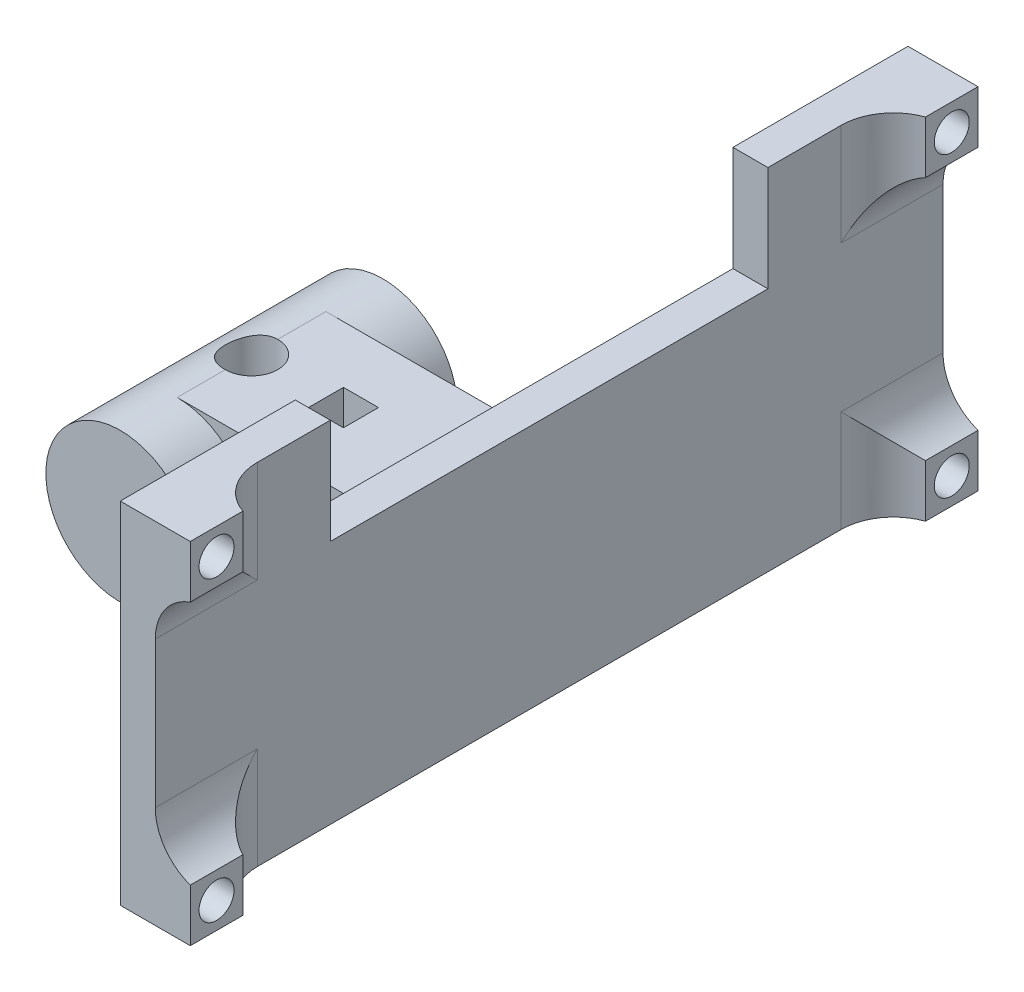
from build123d import *

# Parameters (mm, degrees)
SKETCH1_R               = 4.25
BOSS_EXTRUDE1_DEPTH     = 7.5
SKETCH2_W               = 8.5
SKETCH2_H               = 8.5
BOSS_EXTRUDE2_DEPTH     = 15
SKETCH3_W               = 45
SKETCH3_H               = 20
BOSS_EXTRUDE3_DEPTH     = 4
SKETCH4_R               = 1
CUT_EXTRUDE1_DEPTH      = 36.984371608
CUT_EXTRUDE2_DEPTH      = 2
SKETCH6_W               = 25
SKETCH6_H               = 6
CUT_EXTRUDE3_DEPTH      = 2
CUT_EXTRUDE4_DEPTH      = 32.614869919
CUT_EXTRUDE4_DEPTH_BACK = 32.614869919
SKETCH7_R               = 1.5
CUT_EXTRUDE5_DEPTH      = 34.396294705
CUT_EXTRUDE5_DEPTH_BACK = 34.396294705
SKETCH8_W               = 2
SKETCH8_H               = 2
FILLET1_R               = 3


with BuildPart() as part:
    # Sketch1 → Boss-Extrude1 (new, symmetric)
    with BuildSketch(Plane.XY):
        Circle(SKETCH1_R)
    extrude(amount=BOSS_EXTRUDE1_DEPTH, both=True)

    # Sketch2 → Boss-Extrude2 (add)
    with BuildSketch(Plane(origin=(0, 0, 0), x_dir=(0, 0, -1), z_dir=(1, 0, 0))):
        Rectangle(SKETCH2_W, SKETCH2_H)
    extrude(amount=BOSS_EXTRUDE2_DEPTH)

    # Sketch3 → Boss-Extrude3 (add)
    with BuildSketch(Plane(origin=(15, 0, 0), x_dir=(0, 0, -1), z_dir=(1, 0, 0))):
        with Locations((0, 5.75)):
            Rectangle(SKETCH3_W, SKETCH3_H)
    extrude(amount=BOSS_EXTRUDE3_DEPTH)

    # Sketch4 → Cut-Extrude1 (cut, through all)
    with BuildSketch(Plane(origin=(19, 0, 0), x_dir=(0, 0, -1), z_dir=(1, 0, 0))):
        with Locations((-21, 14.25)):
            Circle(SKETCH4_R)
        with Locations((-21, -2.75)):
            Circle(SKETCH4_R)
        with Locations((21, -2.75)):
            Circle(SKETCH4_R)
        with Locations((21, 14.25)):
            Circle(SKETCH4_R)
    extrude(amount=-CUT_EXTRUDE1_DEPTH, mode=Mode.SUBTRACT)

    # Sketch5 → Cut-Extrude2 (cut)
    with BuildSketch(Plane(origin=(19, 0, 0), x_dir=(0, 0, -1), z_dir=(1, 0, 0))):
        Polygon((19.5, 15.75), (-19.5, 15.75), (-19.5, 12.75), (-22.5, 12.75), (-22.5, -1.25), (-19.5, -1.25), (-19.5, -4.25), (19.5, -4.25), (19.5, -1.25), (22.5, -1.25), (22.5, 12.75), (19.5, 12.75), align=None)
    extrude(amount=-CUT_EXTRUDE2_DEPTH, mode=Mode.SUBTRACT)

    # Sketch6 → Cut-Extrude3 (cut)
    with BuildSketch(Plane(origin=(17, 0, 0), x_dir=(0, 0, -1), z_dir=(1, 0, 0))):
        with Locations((0, 12.75)):
            Rectangle(SKETCH6_W, SKETCH6_H)
    extrude(amount=-CUT_EXTRUDE3_DEPTH, mode=Mode.SUBTRACT)

    # Sketch7 → Cut-Extrude4 (cut, two sides: drawn at the far end of the back side and taken through both)
    with BuildSketch(Plane(origin=(0, 4.25, 0), x_dir=(1, 0, 0), z_dir=(0, 1, 0)).offset(-CUT_EXTRUDE4_DEPTH_BACK)):
        with Locations(Location((0, 0, 0), (0, 0, 270))):
            Circle(SKETCH7_R)
    extrude(amount=CUT_EXTRUDE4_DEPTH + CUT_EXTRUDE4_DEPTH_BACK, mode=Mode.SUBTRACT)

    # Sketch8 → Cut-Extrude5 (cut, two sides: drawn at the far end of the back side and taken through both)
    with BuildSketch(Plane(origin=(0, 0, 0), x_dir=(1, 0, 0), z_dir=(0, 1, 0)).offset(-CUT_EXTRUDE5_DEPTH_BACK)):
        with Locations((5.25, 0)):
            Rectangle(SKETCH8_W, SKETCH8_H)
    extrude(amount=CUT_EXTRUDE5_DEPTH + CUT_EXTRUDE5_DEPTH_BACK, mode=Mode.SUBTRACT)

    # Fillet1
    # the kernel refuses this fillet: 3 mm, written as the material it adds along each edge
    with BuildSketch(Plane(origin=(17, -1.25, -19.5), x_dir=(0, 1, 0), z_dir=(0, 0, -1)), Plane(origin=(17, -4.25, -19.5), x_dir=(0, 0, 1), z_dir=(0, 1, 0)), Plane(origin=(17, 12.75, -19.5), x_dir=(0, 0, 1), z_dir=(0, 1, 0)), Plane(origin=(17, 12.75, -22.5), x_dir=(0, -1, 0), z_dir=(0, 0, 1)), Plane(origin=(17, -1.25, 22.5), x_dir=(0, 1, 0), z_dir=(0, 0, -1)), Plane(origin=(17, 15.75, 19.5), x_dir=(0, 0, -1), z_dir=(0, -1, 0)), Plane(origin=(17, 12.75, 19.5), x_dir=(0, -1, 0), z_dir=(0, 0, 1))) as fillet1_piece_1:
        with BuildLine():
            CenterArc((2.828427125, 3), FILLET1_R, 199.471220634, 70.528779366)
            Line((0, 2), (-0.056568542, 1.98))
            ThreePointArc((-0.056568542, 1.98), (-0.06, 1), (-0.06, 0))
            Line((-0.06, 0), (0, -0.06))
            Line((0, -0.06), (2.828427125, -0.06))
            Line((2.828427125, -0.06), (2.828427125, 0))
        make_face()
    extrude(amount=3)
    with BuildSketch(Plane(origin=(17, -1.25, 19.5), x_dir=(1, 0, 0), z_dir=(0, -1, 0))) as fillet1_piece_2:
        with BuildLine():
            CenterArc((3, -2.828427125), FILLET1_R, 109.471220634, 70.528779366)
            Line((0, -2.828427125), (-0.06, -2.828427125))
            Line((-0.06, -2.828427125), (-0.06, 0))
            Line((-0.06, 0), (0, 0.06))
            ThreePointArc((0, 0.06), (1, 0.06), (1.98, 0.056568542))
            Line((1.98, 0.056568542), (2, 0))
        make_face()
    extrude(amount=3)
    with BuildSketch(Plane(origin=(17, -1.25, -12.428932188), x_dir=(0, 1, 0), z_dir=(0, 0, -1))) as fillet1_piece_3a_section:
        with BuildLine():
            CenterArc((2.828427125, 3), FILLET1_R, 199.471220634, 70.528779366)
            Line((0, 2), (-0.056568542, 1.98))
            ThreePointArc((-0.056568542, 1.98), (-0.06, 1), (-0.06, 0))
            Line((-0.06, 0), (0, -0.06))
            Line((0, -0.06), (2.828427125, -0.06))
            Line((2.828427125, -0.06), (2.828427125, 0))
        make_face()
    fillet1_piece_3a = extrude(amount=10.071067812, mode=Mode.PRIVATE)
    fillet1_piece_3a = split(fillet1_piece_3a, bisect_by=Plane(origin=(17.51353179, -0.571681569, -19.5), z_dir=(0, 0, 1)), keep=Keep.TOP, mode=Mode.PRIVATE)
    with BuildSketch(Plane(origin=(17, -4.25, -19.5), x_dir=(0, 0, 1), z_dir=(0, 1, 0))) as fillet1_piece_3b_section:
        with BuildLine():
            CenterArc((2.828427125, 3), FILLET1_R, 199.471220634, 70.528779366)
            Line((0, 2), (-0.056568542, 1.98))
            ThreePointArc((-0.056568542, 1.98), (-0.06, 1), (-0.06, 0))
            Line((-0.06, 0), (0, -0.06))
            Line((0, -0.06), (2.828427125, -0.06))
            Line((2.828427125, -0.06), (2.828427125, 0))
        make_face()
    fillet1_piece_3b = extrude(amount=10.071067812, mode=Mode.PRIVATE)
    fillet1_piece_3b = split(fillet1_piece_3b, bisect_by=Plane(origin=(17.51353179, -1.25, -18.821681569), z_dir=(0, 1, 0)), keep=Keep.TOP, mode=Mode.PRIVATE)
    fillet1_piece_3 = fillet1_piece_3a & fillet1_piece_3b
    add(fillet1_piece_3)
    with BuildSketch(Plane(origin=(17, 5.678932188, -19.5), x_dir=(0, 0, 1), z_dir=(0, 1, 0))) as fillet1_piece_4a_section:
        with BuildLine():
            CenterArc((2.828427125, 3), FILLET1_R, 199.471220634, 70.528779366)
            Line((0, 2), (-0.056568542, 1.98))
            ThreePointArc((-0.056568542, 1.98), (-0.06, 1), (-0.06, 0))
            Line((-0.06, 0), (0, -0.06))
            Line((0, -0.06), (2.828427125, -0.06))
            Line((2.828427125, -0.06), (2.828427125, 0))
        make_face()
    fillet1_piece_4a = extrude(amount=10.071067812, mode=Mode.PRIVATE)
    fillet1_piece_4a = split(fillet1_piece_4a, bisect_by=Plane(origin=(17.51353179, 12.75, -18.821681569), z_dir=(0, -1, 0)), keep=Keep.TOP, mode=Mode.PRIVATE)
    with BuildSketch(Plane(origin=(17, 12.75, -22.5), x_dir=(0, -1, 0), z_dir=(0, 0, 1))) as fillet1_piece_4b_section:
        with BuildLine():
            CenterArc((2.828427125, 3), FILLET1_R, 199.471220634, 70.528779366)
            Line((0, 2), (-0.056568542, 1.98))
            ThreePointArc((-0.056568542, 1.98), (-0.06, 1), (-0.06, 0))
            Line((-0.06, 0), (0, -0.06))
            Line((0, -0.06), (2.828427125, -0.06))
            Line((2.828427125, -0.06), (2.828427125, 0))
        make_face()
    fillet1_piece_4b = extrude(amount=10.071067812, mode=Mode.PRIVATE)
    fillet1_piece_4b = split(fillet1_piece_4b, bisect_by=Plane(origin=(17.51353179, 12.071681569, -12.5), z_dir=(0, 0, -1)), keep=Keep.TOP, mode=Mode.PRIVATE)
    fillet1_piece_4b = split(fillet1_piece_4b, bisect_by=Plane(origin=(17.51353179, 12.071681569, -19.5), z_dir=(0, 0, 1)), keep=Keep.TOP, mode=Mode.PRIVATE)
    fillet1_piece_4 = fillet1_piece_4a & fillet1_piece_4b
    add(fillet1_piece_4)
    with BuildSketch(Plane(origin=(17, 5.821067812, 19.5), x_dir=(1, 0, 0), z_dir=(0, -1, 0))) as fillet1_piece_5a_section:
        with BuildLine():
            CenterArc((3, -2.828427125), FILLET1_R, 109.471220634, 70.528779366)
            Line((0, -2.828427125), (-0.06, -2.828427125))
            Line((-0.06, -2.828427125), (-0.06, 0))
            Line((-0.06, 0), (0, 0.06))
            ThreePointArc((0, 0.06), (1, 0.06), (1.98, 0.056568542))
            Line((1.98, 0.056568542), (2, 0))
        make_face()
    fillet1_piece_5a = extrude(amount=10.071067812, mode=Mode.PRIVATE)
    fillet1_piece_5a = split(fillet1_piece_5a, bisect_by=Plane(origin=(17.51353179, -1.25, 18.821681569), z_dir=(0, 1, 0)), keep=Keep.TOP, mode=Mode.PRIVATE)
    with BuildSketch(Plane(origin=(17, -1.25, 22.5), x_dir=(0, 1, 0), z_dir=(0, 0, -1))) as fillet1_piece_5b_section:
        with BuildLine():
            CenterArc((2.828427125, 3), FILLET1_R, 199.471220634, 70.528779366)
            Line((0, 2), (-0.056568542, 1.98))
            ThreePointArc((-0.056568542, 1.98), (-0.06, 1), (-0.06, 0))
            Line((-0.06, 0), (0, -0.06))
            Line((0, -0.06), (2.828427125, -0.06))
            Line((2.828427125, -0.06), (2.828427125, 0))
        make_face()
    fillet1_piece_5b = extrude(amount=10.071067812, mode=Mode.PRIVATE)
    fillet1_piece_5b = split(fillet1_piece_5b, bisect_by=Plane(origin=(17.51353179, -0.571681569, 19.5), z_dir=(0, 0, -1)), keep=Keep.TOP, mode=Mode.PRIVATE)
    fillet1_piece_5 = fillet1_piece_5a & fillet1_piece_5b
    add(fillet1_piece_5)
    with BuildSketch(Plane(origin=(17, 12.75, 12.428932188), x_dir=(0, -1, 0), z_dir=(0, 0, 1))) as fillet1_piece_6a_section:
        with BuildLine():
            CenterArc((2.828427125, 3), FILLET1_R, 199.471220634, 70.528779366)
            Line((0, 2), (-0.056568542, 1.98))
            ThreePointArc((-0.056568542, 1.98), (-0.06, 1), (-0.06, 0))
            Line((-0.06, 0), (0, -0.06))
            Line((0, -0.06), (2.828427125, -0.06))
            Line((2.828427125, -0.06), (2.828427125, 0))
        make_face()
    fillet1_piece_6a = extrude(amount=10.071067812, mode=Mode.PRIVATE)
    fillet1_piece_6a = split(fillet1_piece_6a, bisect_by=Plane(origin=(17.51353179, 12.071681569, 12.5), z_dir=(0, 0, 1)), keep=Keep.TOP, mode=Mode.PRIVATE)
    fillet1_piece_6a = split(fillet1_piece_6a, bisect_by=Plane(origin=(17.51353179, 12.071681569, 19.5), z_dir=(0, 0, -1)), keep=Keep.TOP, mode=Mode.PRIVATE)
    with BuildSketch(Plane(origin=(17, 15.75, 19.5), x_dir=(0, 0, -1), z_dir=(0, -1, 0))) as fillet1_piece_6b_section:
        with BuildLine():
            CenterArc((2.828427125, 3), FILLET1_R, 199.471220634, 70.528779366)
            Line((0, 2), (-0.056568542, 1.98))
            ThreePointArc((-0.056568542, 1.98), (-0.06, 1), (-0.06, 0))
            Line((-0.06, 0), (0, -0.06))
            Line((0, -0.06), (2.828427125, -0.06))
            Line((2.828427125, -0.06), (2.828427125, 0))
        make_face()
    fillet1_piece_6b = extrude(amount=10.071067812, mode=Mode.PRIVATE)
    fillet1_piece_6b = split(fillet1_piece_6b, bisect_by=Plane(origin=(17.51353179, 12.75, 18.821681569), z_dir=(0, -1, 0)), keep=Keep.TOP, mode=Mode.PRIVATE)
    fillet1_piece_6 = fillet1_piece_6a & fillet1_piece_6b
    add(fillet1_piece_6)


solid = part.part
